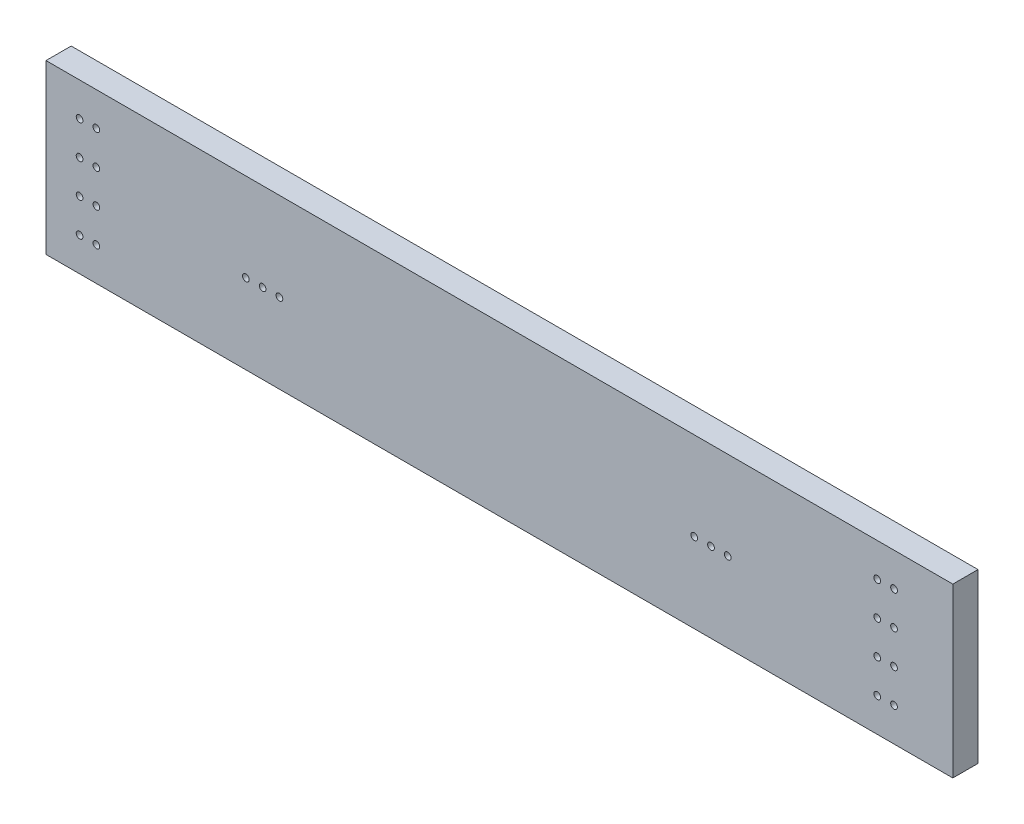
from build123d import *

# Parameters (mm, degrees)
SKETCH1_W           = 685.8
SKETCH1_H           = 127
BOSS_EXTRUDE1_DEPTH = 19.05
SKETCH2_R           = 2.54
CUT_EXTRUDE1_DEPTH  = 350.25


with BuildPart() as part:
    # Sketch1 → Boss-Extrude1 (new body)
    with BuildSketch(Plane.XY):
        Rectangle(SKETCH1_W, SKETCH1_H)
    extrude(amount=BOSS_EXTRUDE1_DEPTH)

    # Sketch2 → Cut-Extrude1 (cut, through all)
    with BuildSketch(Plane.XY.offset(19.05)):
        with Locations((298.45, 38.1)):
            Circle(SKETCH2_R)
        with Locations((298.45, 12.7)):
            Circle(SKETCH2_R)
        with Locations((298.45, -12.7)):
            Circle(SKETCH2_R)
        with Locations((298.45, -38.1)):
            Circle(SKETCH2_R)
        with Locations((285.75, -38.1)):
            Circle(SKETCH2_R)
        with Locations((285.75, -12.7)):
            Circle(SKETCH2_R)
        with Locations((285.75, 12.7)):
            Circle(SKETCH2_R)
        with Locations((285.75, 38.1)):
            Circle(SKETCH2_R)
        with Locations((-317.5, 38.1)):
            Circle(SKETCH2_R)
        with Locations((-304.8, 38.1)):
            Circle(SKETCH2_R)
        with Locations((-317.5, 12.7)):
            Circle(SKETCH2_R)
        with Locations((-304.8, 12.7)):
            Circle(SKETCH2_R)
        with Locations((-317.5, -12.7)):
            Circle(SKETCH2_R)
        with Locations((-304.8, -12.7)):
            Circle(SKETCH2_R)
        with Locations((-317.5, -38.1)):
            Circle(SKETCH2_R)
        with Locations((-304.8, -38.1)):
            Circle(SKETCH2_R)
        with Locations((147.32, -3.175)):
            Circle(SKETCH2_R)
        with Locations((160.02, -3.175)):
            Circle(SKETCH2_R)
        with Locations((172.72, -3.175)):
            Circle(SKETCH2_R)
        with Locations((-191.77, -3.175)):
            Circle(SKETCH2_R)
        with Locations((-179.07, -3.175)):
            Circle(SKETCH2_R)
        with Locations((-166.37, -3.175)):
            Circle(SKETCH2_R)
    extrude(amount=-CUT_EXTRUDE1_DEPTH, mode=Mode.SUBTRACT)


solid = part.part
